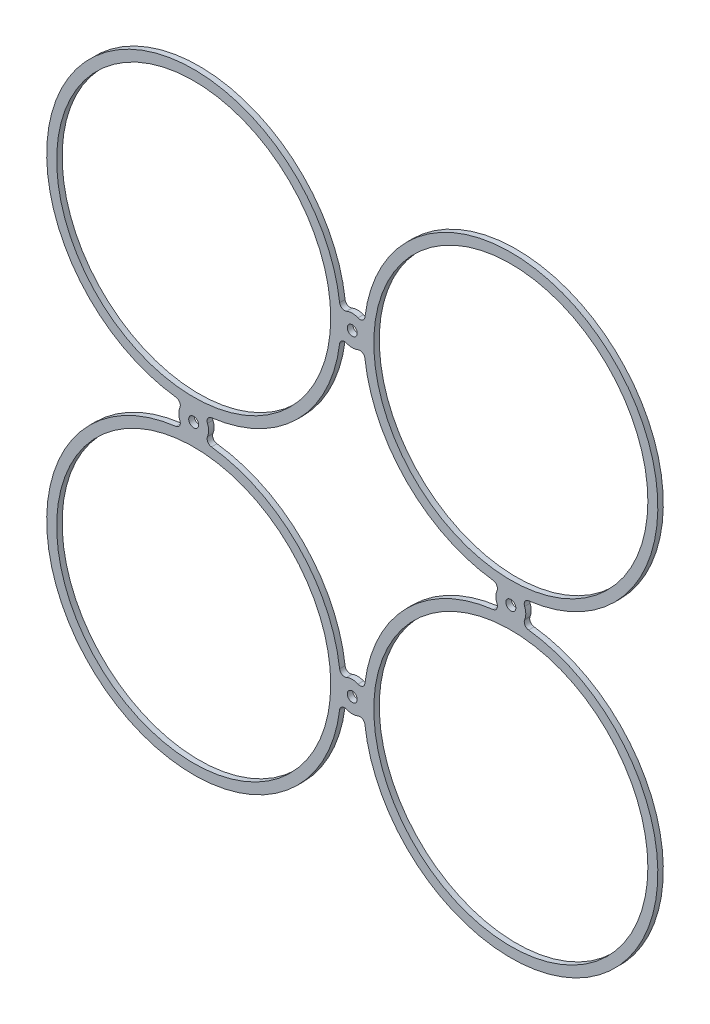
from build123d import *

# Parameters (mm, degrees)
SKETCH1_R           = 27.5
SKETCH1_R_2         = 1
BOSS_EXTRUDE1_DEPTH = 1.1
FILLET1_R           = 1


with BuildPart() as part:
    # Sketch1 → Boss-Extrude1 (new body)
    with BuildSketch(Plane.XY):
        with BuildLine():
            ThreePointArc((-2.376664459, 33.650506126), (-52.679455198, 52.679455198), (-33.650506126, 2.376664459))
            ThreePointArc((-33.650506126, 2.376664459), (-34.819805153, 0), (-33.650506126, -2.376664459))
            ThreePointArc((-33.650506126, -2.376664459), (-52.679455198, -52.679455198), (-2.376664459, -33.650506126))
            ThreePointArc((-2.376664459, -33.650506126), (0, -34.819805153), (2.376664459, -33.650506126))
            ThreePointArc((2.376664459, -33.650506126), (52.679455198, -52.679455198), (33.650506126, -2.376664459))
            ThreePointArc((33.650506126, -2.376664459), (34.819805153, 0), (33.650506126, 2.376664459))
            ThreePointArc((33.650506126, 2.376664459), (52.679455198, 52.679455198), (2.376664459, 33.650506126))
            ThreePointArc((2.376664459, 33.650506126), (0, 34.819805153), (-2.376664459, 33.650506126))
        make_face()
        with BuildLine():
            ThreePointArc((-29.989104181, 2.376664459), (-10.960155108, 10.960155108), (-2.376664459, 29.989104181))
            ThreePointArc((-2.376664459, 29.989104181), (0, 28.819805153), (2.376664459, 29.989104181))
            ThreePointArc((2.376664459, 29.989104181), (10.960155108, 10.960155108), (29.989104181, 2.376664459))
            ThreePointArc((29.989104181, 2.376664459), (28.819805153, 0), (29.989104181, -2.376664459))
            ThreePointArc((29.989104181, -2.376664459), (10.960155108, -10.960155108), (2.376664459, -29.989104181))
            ThreePointArc((2.376664459, -29.989104181), (0, -28.819805153), (-2.376664459, -29.989104181))
            ThreePointArc((-2.376664459, -29.989104181), (-10.960155108, -10.960155108), (-29.989104181, -2.376664459))
            ThreePointArc((-29.989104181, -2.376664459), (-28.819805153, 0), (-29.989104181, 2.376664459))
        make_face(mode=Mode.SUBTRACT)
        with Locations((-31.819805153, 31.819805153)):
            Circle(SKETCH1_R, mode=Mode.SUBTRACT)
        with Locations((0, 31.819805153)):
            Circle(SKETCH1_R_2, mode=Mode.SUBTRACT)
        with Locations((-31.819805153, 0)):
            Circle(SKETCH1_R_2, mode=Mode.SUBTRACT)
        with Locations((31.819805153, 31.819805153)):
            Circle(SKETCH1_R, mode=Mode.SUBTRACT)
        with Locations((-31.819805153, -31.819805153)):
            Circle(SKETCH1_R, mode=Mode.SUBTRACT)
        with Locations((31.819805153, 0)):
            Circle(SKETCH1_R_2, mode=Mode.SUBTRACT)
        with Locations((0, -31.819805153)):
            Circle(SKETCH1_R_2, mode=Mode.SUBTRACT)
        with Locations((31.819805153, -31.819805153)):
            Circle(SKETCH1_R, mode=Mode.SUBTRACT)
    extrude(amount=BOSS_EXTRUDE1_DEPTH)

    # Fillet1
    fillet1_edges = [part.edges().sort_by_distance(p)[0] for p in [
        (2.376664459, -29.989104181, 0.55),
        (-2.376664459, -29.989104181, 0.55),
        (29.989104181, 2.376664459, 0.55),
        (29.989104181, -2.376664459, 0.55),
        (2.376664459, 29.989104181, 0.55),
        (-2.376664459, 29.989104181, 0.55),
        (-29.989104181, 2.376664459, 0.55),
        (-29.989104181, -2.376664459, 0.55),
        (33.650506126, -2.376664459, 0.55),
        (33.650506126, 2.376664459, 0.55),
        (-2.376664459, 33.650506126, 0.55),
        (2.376664459, 33.650506126, 0.55),
        (-33.650506126, 2.376664459, 0.55),
        (-33.650506126, -2.376664459, 0.55),
        (2.376664459, -33.650506126, 0.55),
        (-2.376664459, -33.650506126, 0.55),
    ]]
    fillet(fillet1_edges, radius=FILLET1_R)


solid = part.part
